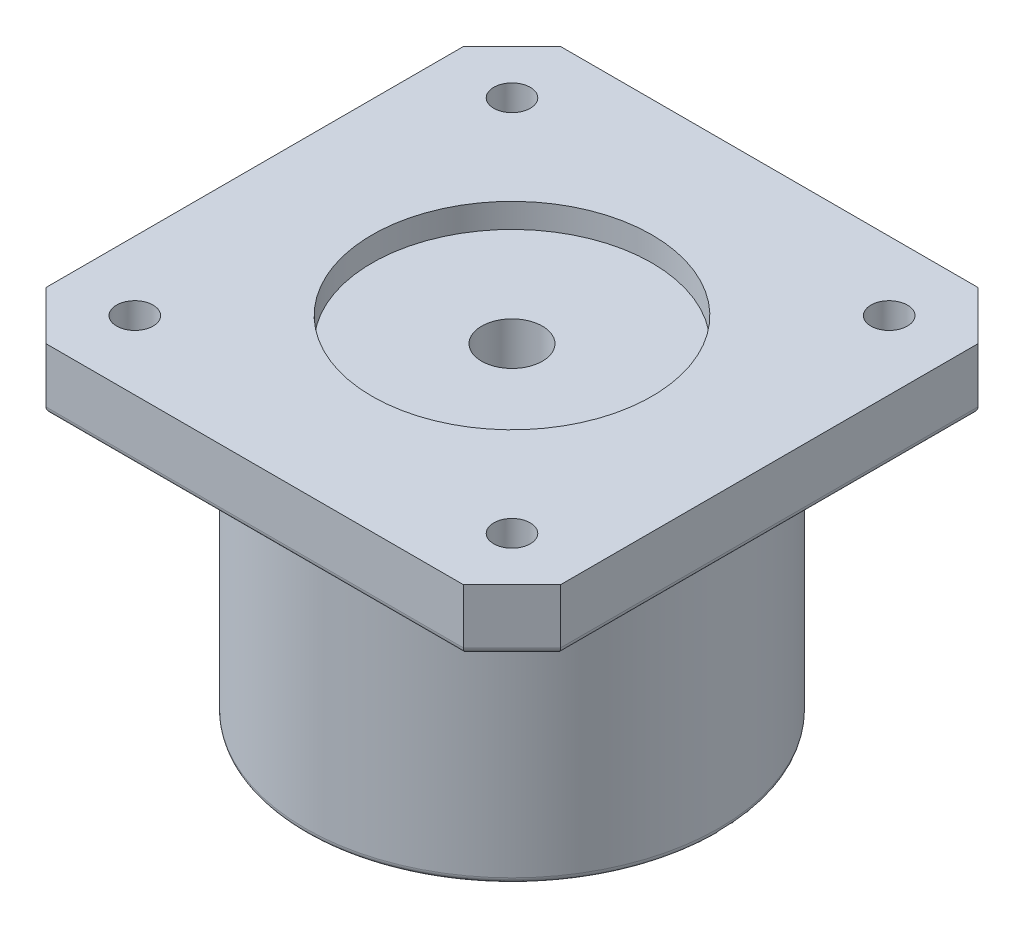
from build123d import *

# Parameters (mm, degrees)
SKETCH1_W           = 42.3
SKETCH1_H           = 42.3
BOSS_EXTRUDE1_DEPTH = 5
CUT_EXTRUDE2_DEPTH  = 5
SKETCH4_R           = 11.5
CUT_EXTRUDE3_DEPTH  = 2
SKETCH5_R           = 1.5
SKETCH5_R_2         = 2.5
CUT_EXTRUDE4_DEPTH  = 5
SKETCH6_R           = 17
BOSS_EXTRUDE2_DEPTH = 23.5
SKETCH5_2_R         = 1.5
SKETCH5_2_R_2       = 2.5
CUT_EXTRUDE5_DEPTH  = 28.5
SKETCH8_R           = 2.8
CUT_EXTRUDE6_DEPTH  = 2.37
SKETCH10_R          = 1.5
CUT_EXTRUDE7_DEPTH  = 10
FILLET1_R           = 0.5
SKETCH12_R          = 2.8
CUT_EXTRUDE8_DEPTH  = 2.37
FILLET2_R           = 0.5
SKETCH13_R          = 7.5
CUT_EXTRUDE9_DEPTH  = 1


with BuildPart() as part:
    # Sketch1 → Boss-Extrude1 (new body)
    with BuildSketch(Plane(origin=(0, 0, 0), x_dir=(1, 0, 0), z_dir=(0, 1, 0))):
        with Locations((21.15, 21.15)):
            Rectangle(SKETCH1_W, SKETCH1_H)
    extrude(amount=BOSS_EXTRUDE1_DEPTH)

    # Sketch2 → Cut-Extrude2 (cut)
    with BuildSketch(Plane(origin=(0, 5, 0), x_dir=(1, 0, 0), z_dir=(0, 1, 0))):
        Polygon((0, 4), (0, 0), (4, 0), align=None)
        Polygon((0, 42.3), (0, 38.3), (4, 42.3), align=None)
        Polygon((42.3, 4), (38.3, 0), (42.3, 0), align=None)
        Polygon((42.3, 42.3), (38.3, 42.3), (42.3, 38.3), align=None)
    extrude(amount=-CUT_EXTRUDE2_DEPTH, mode=Mode.SUBTRACT)

    # Sketch4 → Cut-Extrude3 (cut)
    with BuildSketch(Plane(origin=(0, 5, 0), x_dir=(1, 0, 0), z_dir=(0, 1, 0))):
        with Locations((21.15, 21.15)):
            Circle(SKETCH4_R)
    extrude(amount=-CUT_EXTRUDE3_DEPTH, mode=Mode.SUBTRACT)

    # Sketch5 → Cut-Extrude4 (cut)
    with BuildSketch(Plane(origin=(0, 5, 0), x_dir=(1, 0, 0), z_dir=(0, 1, 0))):
        with Locations((5.65, 36.65)):
            Circle(SKETCH5_R)
        with Locations((36.65, 36.65)):
            Circle(SKETCH5_R)
        with Locations((36.65, 5.65)):
            Circle(SKETCH5_R)
        with Locations((5.65, 5.65)):
            Circle(SKETCH5_R)
        with Locations((21.15, 21.15)):
            Circle(SKETCH5_R_2)
    extrude(amount=-CUT_EXTRUDE4_DEPTH, mode=Mode.SUBTRACT)

    # Sketch6 → Boss-Extrude2 (add)
    with BuildSketch(Plane.XZ):
        with Locations((21.15, -21.15)):
            Circle(SKETCH6_R)
    extrude(amount=BOSS_EXTRUDE2_DEPTH)

    # Sketch5<2> → Cut-Extrude5 (cut)
    with BuildSketch(Plane(origin=(0, 5, 0), x_dir=(1, 0, 0), z_dir=(0, 1, 0))):
        with Locations((5.65, 36.65)):
            Circle(SKETCH5_2_R)
        with Locations((36.65, 36.65)):
            Circle(SKETCH5_2_R)
        with Locations((36.65, 5.65)):
            Circle(SKETCH5_2_R)
        with Locations((5.65, 5.65)):
            Circle(SKETCH5_2_R)
        with Locations((21.15, 21.15)):
            Circle(SKETCH5_2_R_2)
    extrude(amount=-CUT_EXTRUDE5_DEPTH, mode=Mode.SUBTRACT)

    # Sketch8 → Cut-Extrude6 (cut)
    with BuildSketch(Plane(origin=(0, 0, 0), x_dir=(-1, 0, 0), z_dir=(0, -1, 0))):
        with Locations((-5.65, 36.65)):
            Circle(SKETCH8_R)
        with Locations((-36.649920242, 36.57967934)):
            Circle(SKETCH8_R)
        with Locations((-36.579599582, 5.579759099)):
            Circle(SKETCH8_R)
        with Locations((-5.57967934, 5.650079758)):
            Circle(SKETCH8_R)
    extrude(amount=-CUT_EXTRUDE6_DEPTH, mode=Mode.SUBTRACT)

    # Sketch10 → Cut-Extrude7 (cut)
    with BuildSketch(Plane(origin=(0, -23.5, 0), x_dir=(-1, 0, 0), z_dir=(0, -1, 0))):
        with Locations((-21.701644025, 8.15)):
            Circle(SKETCH10_R)
        with Locations((-30.89403218, 11.957611845)):
            Circle(SKETCH10_R)
        with Locations((-34.701644025, 21.15)):
            Circle(SKETCH10_R)
        with Locations((-30.89403218, 30.342388155)):
            Circle(SKETCH10_R)
        with Locations((-21.701644025, 34.15)):
            Circle(SKETCH10_R)
        with Locations((-12.509255869, 30.342388155)):
            Circle(SKETCH10_R)
        with Locations((-8.701644025, 21.15)):
            Circle(SKETCH10_R)
        with Locations((-12.509255869, 11.957611845)):
            Circle(SKETCH10_R)
    extrude(amount=-CUT_EXTRUDE7_DEPTH, mode=Mode.SUBTRACT)

    # Fillet1
    fillet1_edges = [part.edges().sort_by_distance(p)[0] for p in [
        (2, 0, -40.3),
        (0, 0, -21.15),
        (2, 0, -2),
        (21.15, 0, -42.3),
        (40.3, 0, -40.3),
        (42.3, 0, -21.15),
        (40.3, 0, -2),
        (21.15, 0, 0),
    ]]
    fillet(fillet1_edges, radius=FILLET1_R)

    # Sketch12 → Cut-Extrude8 (cut)
    with BuildSketch(Plane(origin=(0, -23.5, 0), x_dir=(-1, 0, 0), z_dir=(0, -1, 0))):
        with Locations((-8.701644025, 21.15)):
            Circle(SKETCH12_R)
        with Locations((-21.701644025, 8.15)):
            Circle(SKETCH12_R)
        with Locations((-34.701644025, 21.15)):
            Circle(SKETCH12_R)
        with Locations((-21.701644025, 34.15)):
            Circle(SKETCH12_R)
    extrude(amount=-CUT_EXTRUDE8_DEPTH, mode=Mode.SUBTRACT)

    # Fillet2
    fillet2_edges = [part.edges().sort_by_distance(p)[0] for p in [
        (4.15, -23.5, -21.15),
    ]]
    fillet(fillet2_edges, radius=FILLET2_R)

    # Sketch13 → Cut-Extrude9 (cut)
    with BuildSketch(Plane(origin=(0, -23.5, 0), x_dir=(-1, 0, 0), z_dir=(0, -1, 0))):
        with Locations((-21.15, 21.15)):
            Circle(SKETCH13_R)
    extrude(amount=-CUT_EXTRUDE9_DEPTH, mode=Mode.SUBTRACT)


solid = part.part
